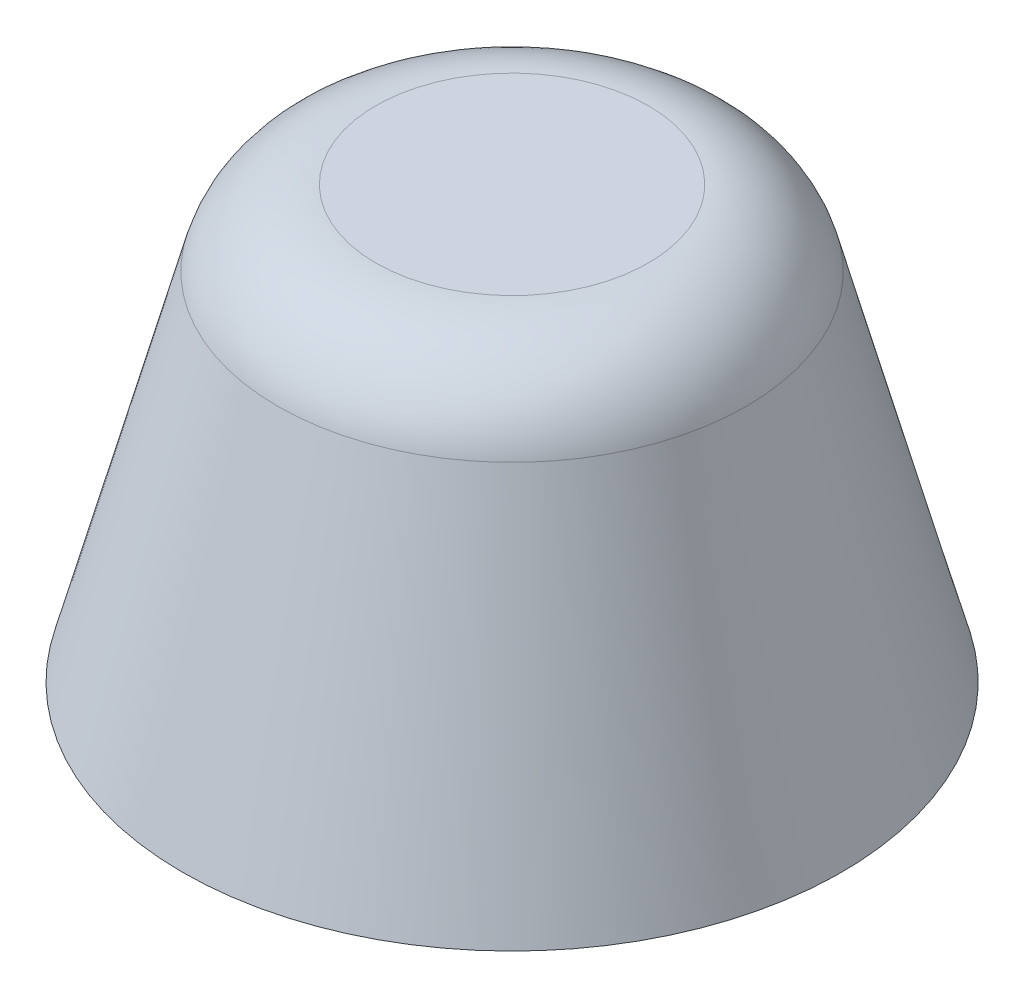
from build123d import *

# Parameters (mm, degrees)
SKETCH1_R           = 6.5
BOSS_EXTRUDE1_DEPTH = 8.5
BOSS_EXTRUDE1_TAPER = 15
SKETCH2_R           = 5.1
CUT_EXTRUDE1_DEPTH  = 2.25
FILLET1_R           = 2


# Read off the part's stored shape, not the designer's step: Shell2
with BuildPart() as part:
    # Sketch1 → Boss-Extrude1 (new body)
    with BuildSketch(Plane(origin=(0, 0, 0), x_dir=(1, 0, 0), z_dir=(0, 1, 0))):
        Circle(SKETCH1_R)
    extrude(amount=BOSS_EXTRUDE1_DEPTH, taper=BOSS_EXTRUDE1_TAPER)

    # Sketch2 → Cut-Extrude1 (cut)
    with BuildSketch(Plane.XZ):
        with Locations(Location((0, 0, 0), (0, 0, 270))):
            Circle(SKETCH2_R)
    extrude(amount=-CUT_EXTRUDE1_DEPTH, mode=Mode.SUBTRACT)

    # Fillet1
    fillet1_edges = [part.edges().sort_by_distance(p)[0] for p in [
        (-4.222431864, 8.5, 0),
    ]]
    fillet(fillet1_edges, radius=FILLET1_R)

    # Shell2 outline → Shell2 (revolve, cut)
    with BuildSketch(Plane.XY):
        with BuildLine():
            Line((4.70654671, 2.25), (3.508814841, 6.719996188))
            ThreePointArc((3.508814841, 6.719996188), (3.205225103, 7.174350339), (2.687777888, 7.35))
            Line((2.687777888, 7.35), (0, 7.35))
            Line((0, 7.35), (0, 2.25))
            Line((0, 2.25), (4.70654671, 2.25))
        make_face()
    revolve(axis=Axis((0, 0, 0), (0, 1, 0)), mode=Mode.SUBTRACT)


solid = part.part
